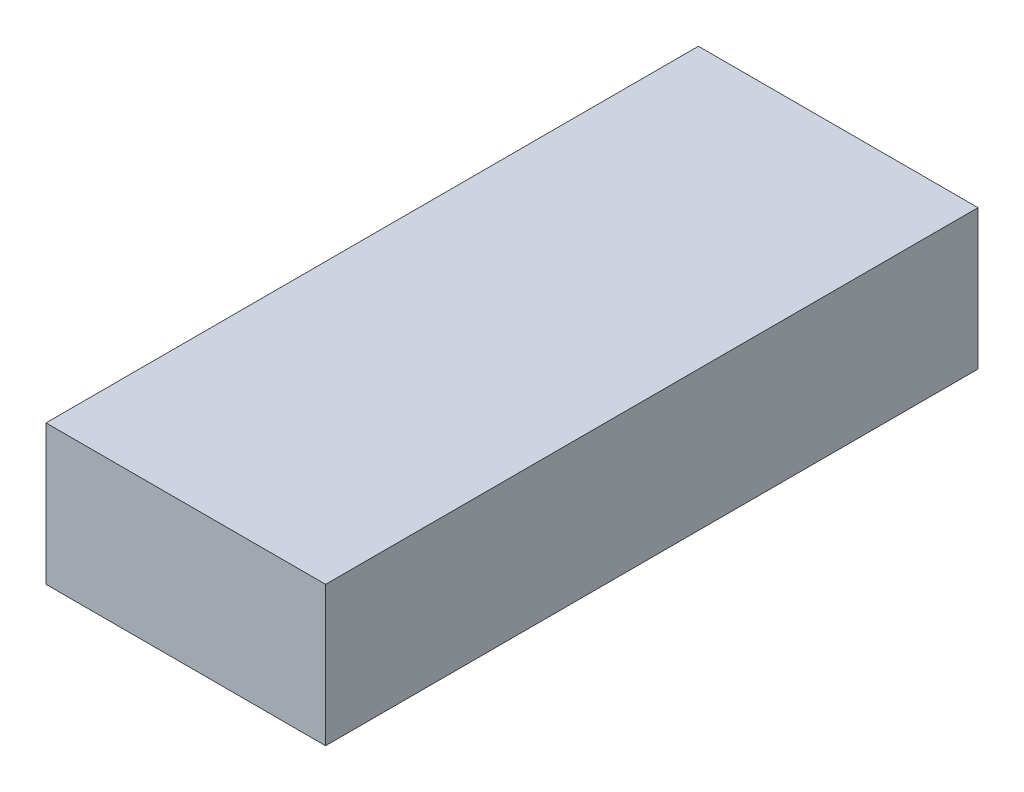
from build123d import *

# Parameters (mm, degrees)
SKETCH1_W           = 88.9
SKETCH1_H           = 19.05
BOSS_EXTRUDE1_DEPTH = 19.05


with BuildPart() as part:
    # Sketch1 → Boss-Extrude1 (new, symmetric)
    with BuildSketch(Plane(origin=(0, 0, 0), x_dir=(0, 0, -1), z_dir=(1, 0, 0))):
        Rectangle(SKETCH1_W, SKETCH1_H)
    extrude(amount=BOSS_EXTRUDE1_DEPTH, both=True)


solid = part.part
